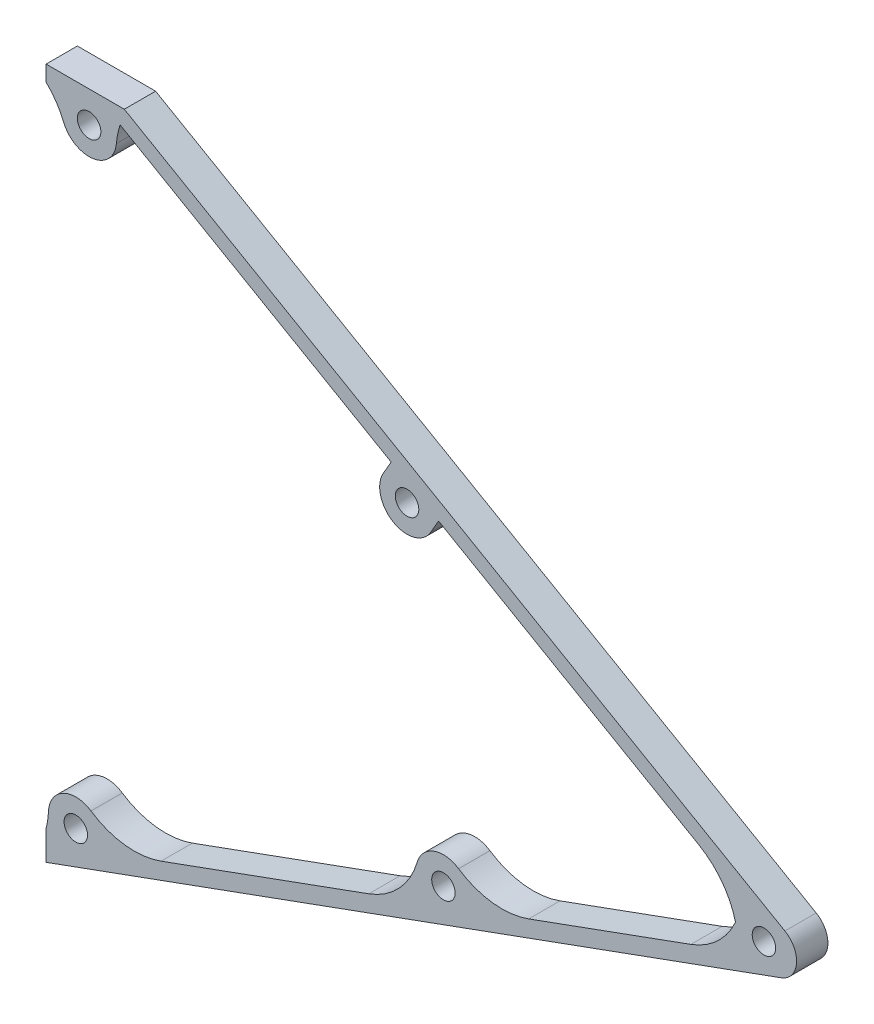
from build123d import *

# Parameters (mm, degrees)
EXTRUDE_THIN1_DEPTH = 4
SKETCH2_R           = 1.5
BOSS_EXTRUDE1_DEPTH = 4
FILLET1_DEPTH       = 4
FILLET1_2_DEPTH     = 4
SKETCH3_W           = 3.133113898
SKETCH3_H           = 7.459824135
CUT_EXTRUDE1_DEPTH  = 95.769370322


with BuildPart() as part:
    # Sketch1 → Extrude-Thin1 (new body)
    with BuildSketch(Plane.XY):
        Polygon((-70, -25.358547654), (30, 11.038475773), (-60, 63), (-70, 63), (-70, 61), (-60.535898385, 61), (25.285605056, 11.450931886), (-70.684040287, -23.479162412), align=None)
    extrude(amount=EXTRUDE_THIN1_DEPTH)

    # Sketch2 → Boss-Extrude1 (add)
    # profile 1 of 17: a face of its own
    with BuildSketch(Plane(origin=(0, 0, 0), x_dir=(-1, 0, 0), z_dir=(0, 0, -1))):
        with BuildLine():
            ThreePointArc((69.699771159, -19.718666382), (66.807539781, -16.271839247), (62.910846986, -18.521595881))
            ThreePointArc((62.910846986, -18.521595881), (62.703305352, -19.561418618), (62.816669308, -20.615673554))
            Line((62.816669308, -20.615673554), (68.214792437, -22.580429694))
            ThreePointArc((68.214792437, -22.580429694), (68.979296275, -21.845692505), (69.488695332, -20.915736884))
            ThreePointArc((69.488695332, -20.915736884), (69.646598295, -20.326435004), (69.699771159, -19.718666382))
        make_face()
        with Locations((66.199771159, -19.718666382)):
            Circle(SKETCH2_R, mode=Mode.SUBTRACT)
    # profile 2 of 17: a face of its own
    with BuildSketch(Plane(origin=(0, 0, 0), x_dir=(-1, 0, 0), z_dir=(0, 0, -1))):
        with BuildLine():
            ThreePointArc((69.488695332, -20.915736884), (68.979296275, -21.845692505), (68.214792437, -22.580429694))
            Line((68.214792437, -22.580429694), (68.804655045, -22.795122125))
            Line((68.804655045, -22.795122125), (69.488695332, -20.915736884))
        make_face()
    # profile 3 of 17: a face of its own
    with BuildSketch(Plane(origin=(0, 0, 0), x_dir=(-1, 0, 0), z_dir=(0, 0, -1))):
        with BuildLine():
            Line((62.910846986, -18.521595881), (62.2268067, -20.400981122))
            Line((62.2268067, -20.400981122), (62.816669308, -20.615673554))
            ThreePointArc((62.816669308, -20.615673554), (62.703305352, -19.561418618), (62.910846986, -18.521595881))
        make_face()
    # profile 4 of 17: a face of its own
    with BuildSketch(Plane(origin=(0, 0, 0), x_dir=(-1, 0, 0), z_dir=(0, 0, -1))):
        with BuildLine():
            ThreePointArc((22.71514012, -2.617659216), (19.822908742, 0.82916792), (15.926215947, -1.420588714))
            ThreePointArc((15.926215947, -1.420588714), (15.718674313, -2.460411452), (15.832038269, -3.514666388))
            Line((15.832038269, -3.514666388), (21.230161397, -5.479422527))
            ThreePointArc((21.230161397, -5.479422527), (21.994665236, -4.744685339), (22.504064292, -3.814729718))
            ThreePointArc((22.504064292, -3.814729718), (22.661967255, -3.225427838), (22.71514012, -2.617659216))
        make_face()
        with Locations((19.21514012, -2.617659216)):
            Circle(SKETCH2_R, mode=Mode.SUBTRACT)
    # profile 5 of 17: a face of its own
    with BuildSketch(Plane(origin=(0, 0, 0), x_dir=(-1, 0, 0), z_dir=(0, 0, -1))):
        with BuildLine():
            ThreePointArc((22.504064292, -3.814729718), (21.994665236, -4.744685339), (21.230161397, -5.479422527))
            Line((21.230161397, -5.479422527), (21.820024006, -5.694114959))
            Line((21.820024006, -5.694114959), (22.504064292, -3.814729718))
        make_face()
    # profile 6 of 17: a face of its own
    with BuildSketch(Plane(origin=(0, 0, 0), x_dir=(-1, 0, 0), z_dir=(0, 0, -1))):
        with BuildLine():
            Line((15.926215947, -1.420588714), (15.24217566, -3.299973956))
            Line((15.24217566, -3.299973956), (15.832038269, -3.514666388))
            ThreePointArc((15.832038269, -3.514666388), (15.718674313, -2.460411452), (15.926215947, -1.420588714))
        make_face()
    # profile 7 of 17: a face of its own
    with BuildSketch(Plane(origin=(0, 0, 0), x_dir=(-1, 0, 0), z_dir=(0, 0, -1))):
        with BuildLine():
            ThreePointArc((-18.249808849, 11.760273971), (-18.650603728, 13.386597315), (-19.761196061, 14.640450906))
            Line((-19.761196061, 14.640450906), (-22.499808851, 13.059312075))
            ThreePointArc((-22.499808851, 13.059312075), (-20.99980885, 13.059312077), (-20.249808849, 11.760273971))
            ThreePointArc((-20.249808849, 11.760273971), (-20.889444174, 10.531545919), (-22.262839017, 10.350735022))
            Line((-22.262839017, 10.350735022), (-19.291270082, 9.269172381))
            ThreePointArc((-19.291270082, 9.269172381), (-18.520653721, 10.410252801), (-18.249808849, 11.760273971))
        make_face()
    # profile 8 of 17: a face of its own
    with BuildSketch(Plane(origin=(0, 0, 0), x_dir=(-1, 0, 0), z_dir=(0, 0, -1))):
        with BuildLine():
            Line((-22.499808851, 13.059312075), (-25.238421636, 11.478173246))
            ThreePointArc((-25.238421636, 11.478173246), (-25.236490292, 11.455228871), (-25.234408046, 11.432297698))
            Line((-25.234408046, 11.432297698), (-22.262839017, 10.350735022))
            ThreePointArc((-22.262839017, 10.350735022), (-23.244100894, 11.62954033), (-22.499808851, 13.059312075))
        make_face()
    # profile 9 of 17: a face of its own
    with BuildSketch(Plane(origin=(0, 0, 0), x_dir=(-1, 0, 0), z_dir=(0, 0, -1))):
        with BuildLine():
            ThreePointArc((-18.249808849, 11.760273971), (-18.650603728, 13.386597315), (-19.761196061, 14.640450906))
            Line((-19.761196061, 14.640450906), (-22.499808851, 13.059312075))
            ThreePointArc((-22.499808851, 13.059312075), (-20.99980885, 13.059312077), (-20.249808849, 11.760273971))
            ThreePointArc((-20.249808849, 11.760273971), (-20.889444174, 10.531545919), (-22.262839017, 10.350735022))
            Line((-22.262839017, 10.350735022), (-19.291270082, 9.269172381))
            ThreePointArc((-19.291270082, 9.269172381), (-18.520653721, 10.410252801), (-18.249808849, 11.760273971))
        make_face()
    # profile 10 of 17: a face of its own
    with BuildSketch(Plane(origin=(0, 0, 0), x_dir=(-1, 0, 0), z_dir=(0, 0, -1))):
        with BuildLine():
            Line((-22.499808851, 13.059312075), (-25.238421636, 11.478173246))
            ThreePointArc((-25.238421636, 11.478173246), (-25.236490292, 11.455228871), (-25.234408046, 11.432297698))
            Line((-25.234408046, 11.432297698), (-22.262839017, 10.350735022))
            ThreePointArc((-22.262839017, 10.350735022), (-23.244100894, 11.62954033), (-22.499808851, 13.059312075))
        make_face()
    # profile 11 of 17: a face of its own
    with BuildSketch(Plane(origin=(0, 0, 0), x_dir=(-1, 0, 0), z_dir=(0, 0, -1))):
        with BuildLine():
            ThreePointArc((-25.234408046, 11.432297698), (-25.236490292, 11.455228871), (-25.238421636, 11.478173246))
            Line((-25.238421636, 11.478173246), (-25.285605056, 11.450931886))
            Line((-25.285605056, 11.450931886), (-25.234408046, 11.432297698))
        make_face()
    # profile 12 of 17: a face of its own
    with BuildSketch(Plane(origin=(0, 0, 0), x_dir=(-1, 0, 0), z_dir=(0, 0, -1))):
        with BuildLine():
            ThreePointArc((27.36379332, 37.517949192), (27.244533712, 38.42381585), (26.894882233, 39.267949192))
            ThreePointArc((26.894882233, 39.267949192), (26.231736995, 40.09532048), (25.351261913, 40.686140662))
            Line((25.351261913, 40.686140662), (20.376324727, 37.813859338))
            ThreePointArc((20.376324727, 37.813859338), (20.447752473, 36.75593546), (20.832704407, 35.767949192))
            ThreePointArc((20.832704407, 35.767949192), (24.769659978, 34.1372088), (27.36379332, 37.517949192))
        make_face()
        with Locations((23.86379332, 37.517949192)):
            Circle(SKETCH2_R, mode=Mode.SUBTRACT)
    # profile 13 of 17: a face of its own
    with BuildSketch(Plane(origin=(0, 0, 0), x_dir=(-1, 0, 0), z_dir=(0, 0, -1))):
        with BuildLine():
            Line((26.894882233, 39.267949192), (25.894882233, 41))
            Line((25.894882233, 41), (25.351261913, 40.686140662))
            ThreePointArc((25.351261913, 40.686140662), (26.231736995, 40.09532048), (26.894882233, 39.267949192))
        make_face()
    # profile 14 of 17: a face of its own
    with BuildSketch(Plane(origin=(0, 0, 0), x_dir=(-1, 0, 0), z_dir=(0, 0, -1))):
        with BuildLine():
            ThreePointArc((20.832704407, 35.767949192), (20.447752473, 36.75593546), (20.376324727, 37.813859338))
            Line((20.376324727, 37.813859338), (19.832704407, 37.5))
            Line((19.832704407, 37.5), (20.832704407, 35.767949192))
        make_face()
    # profile 15 of 17: a face of its own
    with BuildSketch(Plane(origin=(0, 0, 0), x_dir=(-1, 0, 0), z_dir=(0, 0, -1))):
        with BuildLine():
            ThreePointArc((61, 59), (64.5, 55.5), (68, 59))
            ThreePointArc((68, 59), (67.839385021, 60.048097173), (67.372281323, 61))
            Line((67.372281323, 61), (61.627718677, 61))
            ThreePointArc((61.627718677, 61), (61.160614979, 60.048097173), (61, 59))
        make_face()
        with Locations((64.5, 59)):
            Circle(SKETCH2_R, mode=Mode.SUBTRACT)
    # profile 16 of 17: a face of its own
    with BuildSketch(Plane(origin=(0, 0, 0), x_dir=(-1, 0, 0), z_dir=(0, 0, -1))):
        with BuildLine():
            Line((61, 61), (61, 59))
            ThreePointArc((61, 59), (61.160614979, 60.048097173), (61.627718677, 61))
            Line((61.627718677, 61), (61, 61))
        make_face()
    # profile 17 of 17: a face of its own
    with BuildSketch(Plane(origin=(0, 0, 0), x_dir=(-1, 0, 0), z_dir=(0, 0, -1))):
        with BuildLine():
            ThreePointArc((67.372281323, 61), (67.839385021, 60.048097173), (68, 59))
            Line((68, 59), (68, 61))
            Line((68, 61), (67.372281323, 61))
        make_face()
    extrude(amount=-BOSS_EXTRUDE1_DEPTH)

    # Fillet1: read off the stored shape, not the designer's step
    # Fillet1 outline → Fillet1 (cut)
    with BuildSketch(Plane.XY):
        with BuildLine():
            Line((30, 11.038475773), (24.428407585, 14.255236154))
            ThreePointArc((24.428407585, 14.255236154), (25.916991679, 11.395692714), (23.954468015, 8.83808208))
            Line((23.954468015, 8.83808208), (30, 11.038475773))
        make_face()
    extrude(amount=FILLET1_DEPTH, mode=Mode.SUBTRACT)

    # Fillet1 2 outline → Fillet1 2 (add)
    with BuildSketch(Plane.XY):
        with BuildLine():
            ThreePointArc((13.416857787, 18.303356317), (16.398283352, 15.667788657), (18.115840977, 12.078204963))
            ThreePointArc((18.115840977, 12.078204963), (15.801052244, 8.841405863), (12.407259711, 6.763597514))
            Line((12.407259711, 6.763597514), (19.291270082, 9.269172381))
            ThreePointArc((19.291270082, 9.269172381), (18.263127406, 12.06531907), (19.761196061, 14.640450906))
            Line((19.761196061, 14.640450906), (13.416857787, 18.303356317))
        make_face()
        with BuildLine():
            ThreePointArc((-69.488695332, -20.915736884), (-69.65911424, -20.25059255), (-69.696395151, -19.564976241))
            ThreePointArc((-69.696395151, -19.564976241), (-69.990650839, -21.572424943), (-70.684040287, -23.479162412))
            Line((-70.684040287, -23.479162412), (-68.804655045, -22.795122125))
            Line((-68.804655045, -22.795122125), (-69.488695332, -20.915736884))
        make_face()
        with BuildLine():
            Line((-62.2268067, -20.400981122), (-55.29724871, -17.878828277))
            ThreePointArc((-55.29724871, -17.878828277), (-59.906584574, -18.410948313), (-64.259910155, -16.80543119))
            ThreePointArc((-64.259910155, -16.80543119), (-63.448161827, -17.555648564), (-62.910846986, -18.521595881))
            Line((-62.910846986, -18.521595881), (-62.2268067, -20.400981122))
        make_face()
        with BuildLine():
            ThreePointArc((-22.504064292, -3.814729718), (-22.713356211, -2.729391821), (-22.573751348, -1.632910203))
            ThreePointArc((-22.573751348, -1.632910203), (-24.876585704, -5.661071418), (-28.749581995, -8.216267804))
            Line((-28.749581995, -8.216267804), (-21.820024006, -5.694114959))
            Line((-21.820024006, -5.694114959), (-22.504064292, -3.814729718))
        make_face()
        with BuildLine():
            Line((-15.24217566, -3.299973956), (-8.312617671, -0.777821111))
            ThreePointArc((-8.312617671, -0.777821111), (-12.921953535, -1.309941147), (-17.275279116, 0.295575976))
            ThreePointArc((-17.275279116, 0.295575976), (-16.463530787, -0.454641397), (-15.926215947, -1.420588714))
            Line((-15.926215947, -1.420588714), (-15.24217566, -3.299973956))
        make_face()
        with BuildLine():
            ThreePointArc((-70, 61), (-68.69628443, 59.445406029), (-67.733186639, 57.65966267))
            ThreePointArc((-67.733186639, 57.65966267), (-67.93264863, 58.316682078), (-68, 59))
            Line((-68, 59), (-68, 61))
            Line((-68, 61), (-70, 61))
        make_face()
        with BuildLine():
            ThreePointArc((-61.013092006, 58.697555558), (-60.842404557, 59.862852348), (-60.535898385, 61))
            Line((-60.535898385, 61), (-61, 61))
            Line((-61, 61), (-61, 59))
            ThreePointArc((-61, 59), (-61.003274533, 58.848636166), (-61.013092006, 58.697555558))
        make_face()
    extrude(amount=FILLET1_2_DEPTH)

    # Sketch3 → Cut-Extrude1 (cut, through all)
    with BuildSketch(Plane.XY.offset(4)):
        with Locations((-71.566556949, -21.628635587)):
            Rectangle(SKETCH3_W, SKETCH3_H)
    extrude(amount=-CUT_EXTRUDE1_DEPTH, mode=Mode.SUBTRACT)


solid = part.part
